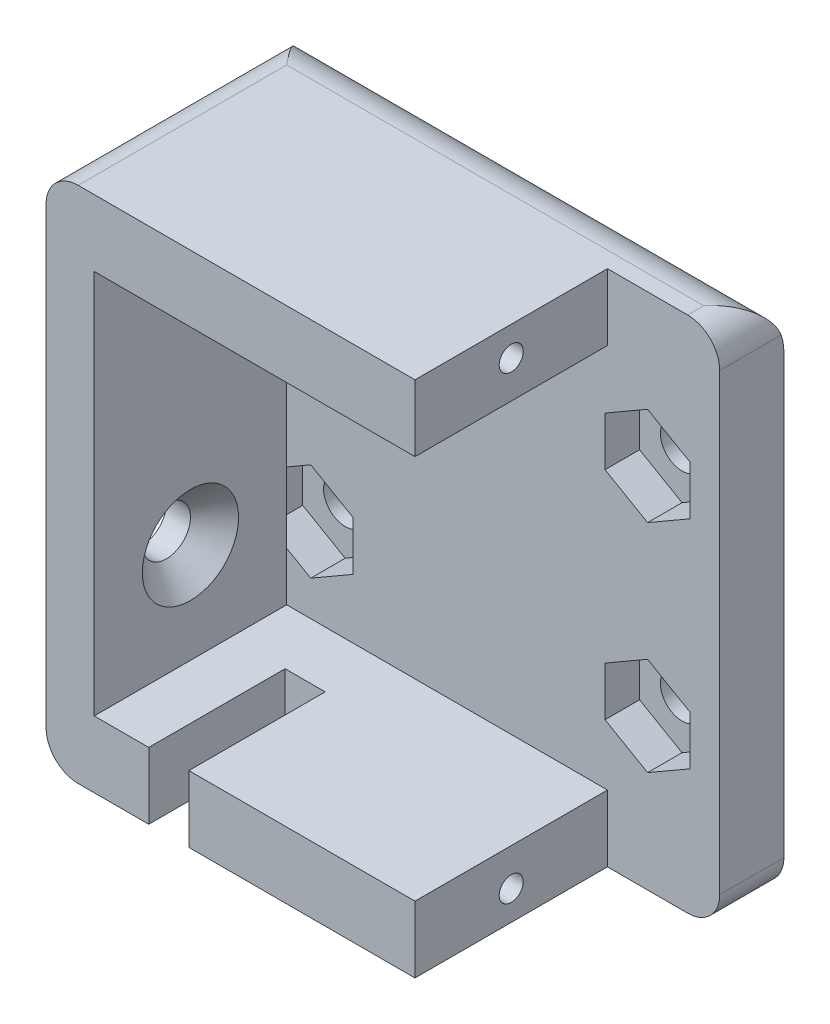
from build123d import *

# Parameters (mm, degrees)
SKETCH_1_W             = 30
SKETCH_1_H             = 32.3
EXTRUDE_417_DEPTH      = 4
EXTRUDE_710_DEPTH      = 12
SKETCH_4_R             = 1.5
CUT_EXTRUDE_1014_DEPTH = 36.296210845
CHAMFER_1_SIZE         = 1.5
SKETCH_3_R             = 0.75
CUT_EXTRUDE_1313_DEPTH = 10
SKETCH_5_W             = 2.5
SKETCH_5_H             = 8.5
CUT_EXTRUDE_1575_DEPTH = 4.15
FILLET_1_R             = 2
CUT_EXTRUDE_2459_REACH = 29.236
SKETCH_7_R             = 1.35
CUT_EXTRUDE_3094_DEPTH = 2.15
FILLET_2_R             = 3


with BuildPart() as part:
    # Эскиз1 → Extrude 417 (new body)
    with BuildSketch(Plane.XY):
        Rectangle(SKETCH_1_W, SKETCH_1_H)
    extrude(amount=EXTRUDE_417_DEPTH)

    # Эскиз2 → Extrude 710 (add)
    with BuildSketch(Plane.XY.offset(4)):
        Polygon((8, 16.15), (-15, 16.15), (-15, -16.15), (8, -16.15), (8, -12), (-12, -12), (-12, 12), (8, 12), align=None)
    extrude(amount=EXTRUDE_710_DEPTH)

    # Эскиз4 → Cut-Extrude 1014 (cut, through all)
    with BuildSketch(Plane(origin=(-12, 0, 0), x_dir=(0, 0, -1), z_dir=(1, 0, 0))):
        with Locations(Location((-10, -5.77, 0), (0, 0, 90))):
            Circle(SKETCH_4_R)
    extrude(amount=-CUT_EXTRUDE_1014_DEPTH, mode=Mode.SUBTRACT)

    # Фаска1
    chamfer_1_edges = [part.edges().sort_by_distance(p)[0] for p in [
        (-12, -7.27, 10),
    ]]
    chamfer(chamfer_1_edges, length=CHAMFER_1_SIZE)

    # Эскиз3 → Cut-Extrude 1313 (cut)
    with BuildSketch(Plane(origin=(8, 0, 0), x_dir=(0, 0, -1), z_dir=(1, 0, 0))):
        with Locations((-10, 14.32)):
            Circle(SKETCH_3_R)
    cut_extrude_1313 = extrude(amount=-CUT_EXTRUDE_1313_DEPTH, mode=Mode.SUBTRACT)

    # Зеркальное отражение2: Cut-Extrude 1313 across plane
    add(cut_extrude_1313.mirror(Plane.ZX), mode=Mode.SUBTRACT)

    # Эскиз5 → Cut-Extrude 1575 (cut)
    with BuildSketch(Plane.XZ.offset(16.15)):
        with Locations((-7.35, 11.75)):
            Rectangle(SKETCH_5_W, SKETCH_5_H)
    extrude(amount=-CUT_EXTRUDE_1575_DEPTH, mode=Mode.SUBTRACT)

    # Скругление1
    fillet_1_edges = [part.edges().sort_by_distance(p)[0] for p in [
        (15, -16.15, 2),
        (-15, -16.15, 8),
        (-15, 16.15, 8),
        (15, 16.15, 2),
    ]]
    fillet(fillet_1_edges, radius=FILLET_1_R)

    # Эскиз7 → Cut-Extrude 2459 (cut, up to next)
    with BuildSketch(Plane(origin=(0, 0, 0), x_dir=(-1, 0, 0), z_dir=(0, 0, -1)), mode=Mode.PRIVATE) as cut_extrude_2459_sk1:
        with Locations((10.5, 6.75)):
            Circle(SKETCH_7_R)
    cut_extrude_2459_tool1 = extrude(cut_extrude_2459_sk1.sketch, amount=-CUT_EXTRUDE_2459_REACH, mode=Mode.PRIVATE) & part.part
    # Эскиз7 → Cut-Extrude 2459 (cut, up to next)
    with BuildSketch(Plane(origin=(0, 0, 0), x_dir=(-1, 0, 0), z_dir=(0, 0, -1)), mode=Mode.PRIVATE) as cut_extrude_2459_sk2:
        with Locations((-10.5, 6.75)):
            Circle(SKETCH_7_R)
    cut_extrude_2459_tool2 = extrude(cut_extrude_2459_sk2.sketch, amount=-CUT_EXTRUDE_2459_REACH, mode=Mode.PRIVATE) & part.part
    # Эскиз7 → Cut-Extrude 2459 (cut, up to next)
    with BuildSketch(Plane(origin=(0, 0, 0), x_dir=(-1, 0, 0), z_dir=(0, 0, -1)), mode=Mode.PRIVATE) as cut_extrude_2459_sk3:
        with Locations((-10.5, -6.75)):
            Circle(SKETCH_7_R)
    cut_extrude_2459_tool3 = extrude(cut_extrude_2459_sk3.sketch, amount=-CUT_EXTRUDE_2459_REACH, mode=Mode.PRIVATE) & part.part
    # Эскиз7 → Cut-Extrude 2459 (cut, up to next)
    with BuildSketch(Plane(origin=(0, 0, 0), x_dir=(-1, 0, 0), z_dir=(0, 0, -1)), mode=Mode.PRIVATE) as cut_extrude_2459_sk4:
        with Locations((10.5, -6.75)):
            Circle(SKETCH_7_R)
    cut_extrude_2459_tool4 = extrude(cut_extrude_2459_sk4.sketch, amount=-CUT_EXTRUDE_2459_REACH, mode=Mode.PRIVATE) & part.part
    add(cut_extrude_2459_tool1.solids().sort_by_distance((-10.5, 6.75, 0))[0], mode=Mode.SUBTRACT)
    add(cut_extrude_2459_tool2.solids().sort_by_distance((10.5, 6.75, 0))[0], mode=Mode.SUBTRACT)
    add(cut_extrude_2459_tool3.solids().sort_by_distance((10.5, -6.75, 0))[0], mode=Mode.SUBTRACT)
    add(cut_extrude_2459_tool4.solids().sort_by_distance((-10.5, -6.75, 0))[0], mode=Mode.SUBTRACT)

    # Эскиз8 → Cut-Extrude 3094 (cut)
    with BuildSketch(Plane.XY.offset(4)):
        Polygon((10.5, 9.809956427), (7.85, 8.279978213), (7.85, 5.220021787), (10.5, 3.690043573), (13.15, 5.220021787), (13.15, 8.279978213), align=None)
        Polygon((-13.15, 8.279978213), (-10.5, 9.809956427), (-7.85, 8.279978213), (-7.85, 5.220021787), (-10.5, 3.690043573), (-13.15, 5.220021787), align=None)
        Polygon((-10.5, -9.809956427), (-7.85, -8.279978213), (-7.85, -5.220021787), (-10.5, -3.690043573), (-13.15, -5.220021787), (-13.15, -8.279978213), align=None)
        Polygon((13.15, -8.279978213), (10.5, -9.809956427), (7.85, -8.279978213), (7.85, -5.220021787), (10.5, -3.690043573), (13.15, -5.220021787), align=None)
    extrude(amount=-CUT_EXTRUDE_3094_DEPTH, mode=Mode.SUBTRACT)

    # Скругление2
    # the kernel refuses this fillet: 3 mm, written as the material it takes off along each edge
    with BuildSketch(Plane(origin=(20.5, 16.15, 0), x_dir=(0, -1, 0), z_dir=(-1, 0, 0))) as fillet_2_piece_1:
        with BuildLine():
            CenterArc((FILLET_2_R, FILLET_2_R), FILLET_2_R, 180, 90)
            Line((0, FILLET_2_R), (0, 0))
            Line((0, 0), (FILLET_2_R, 0))
        make_face()
    extrude(amount=41, mode=Mode.SUBTRACT)


solid = part.part
